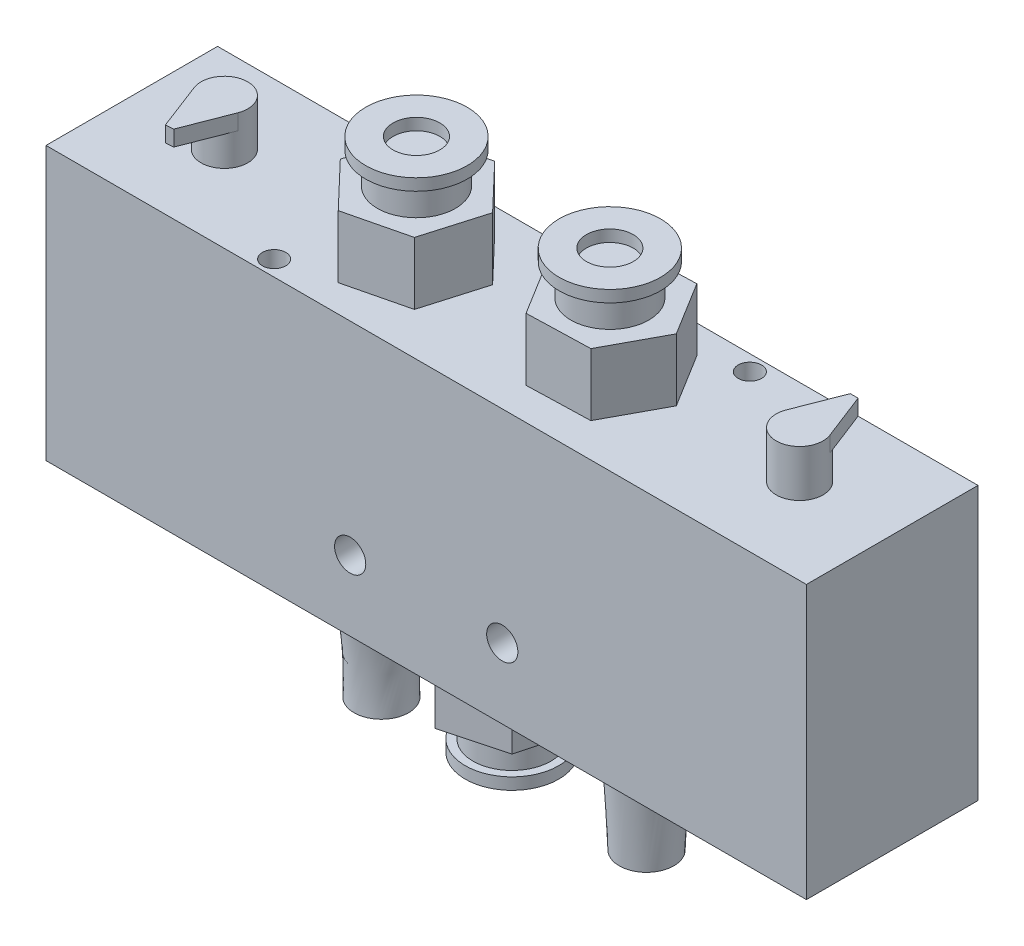
from build123d import *

# Parameters (mm, degrees)
SKETCH1_W            = 97.5
SKETCH1_H            = 35
BOSS_EXTRUDE1_DEPTH  = 22
SKETCH2_R            = 3
BOSS_EXTRUDE2_DEPTH  = 4
BOSS_EXTRUDE3_DEPTH  = 2
BOSS_EXTRUDE4_DEPTH  = 8
SKETCH6_R            = 5
BOSS_EXTRUDE5_DEPTH  = 4
SKETCH7_R            = 6.5
SKETCH7_R_2          = 3
BOSS_EXTRUDE6_DEPTH  = 1.5
BOSS_EXTRUDE8_DEPTH  = 8
BOSS_EXTRUDE9_DEPTH  = 4
SKETCH14_R           = 4
BOSS_EXTRUDE10_DEPTH = 2
SKETCH20_R           = 5
BOSS_EXTRUDE11_DEPTH = 4
SKETCH21_R           = 6
SKETCH21_R_2         = 3
BOSS_EXTRUDE12_DEPTH = 1.5
SKETCH22_R           = 2
CUT_EXTRUDE1_DEPTH   = 28.5
SKETCH25_R           = 1.5
CUT_EXTRUDE3_DEPTH   = 39


with BuildPart() as part:
    # Sketch1 → Boss-Extrude1 (new body)
    with BuildSketch(Plane.XY):
        Rectangle(SKETCH1_W, SKETCH1_H)
    extrude(amount=BOSS_EXTRUDE1_DEPTH)

    # Sketch2 → Boss-Extrude2 (add)
    with BuildSketch(Plane(origin=(0, 17.5, 0), x_dir=(1, 0, 0), z_dir=(0, 1, 0))):
        with Locations((-36.875, -11)):
            Circle(SKETCH2_R)
        with Locations((36.875, -11)):
            Circle(SKETCH2_R)
    extrude(amount=BOSS_EXTRUDE2_DEPTH)

    # Sketch3 → Boss-Extrude3 (add)
    with BuildSketch(Plane(origin=(0, 21.5, 0), x_dir=(1, 0, 0), z_dir=(0, 1, 0))):
        with BuildLine():
            Line((37.375, -4), (36.375, -4))
            Line((36.375, -4), (34.078450474, -9.914039252))
            ThreePointArc((34.078450474, -9.914039252), (36.875, -14), (39.671549526, -9.914039252))
            Line((39.671549526, -9.914039252), (37.375, -4))
        make_face()
        with BuildLine():
            Line((-37.364008965, -18.083081838), (-36.368911019, -17.984187559))
            Line((-36.368911019, -17.984187559), (-34.072361493, -12.070148307))
            ThreePointArc((-34.072361493, -12.070148307), (-36.928299188, -8.000473505), (-39.637849875, -12.169042586))
            Line((-39.637849875, -12.169042586), (-37.364008965, -18.083081838))
        make_face()
    extrude(amount=BOSS_EXTRUDE3_DEPTH)

    # Sketch4 → Boss-Extrude4 (add)
    with BuildSketch(Plane(origin=(0, 17.5, 0), x_dir=(1, 0, 0), z_dir=(0, 1, 0))):
        Polygon((-18.080730298, -4.902882533), (-20.354117415, -12.659495476), (-14.773387117, -18.506612943), (-6.919269702, -16.597117467), (-4.645882585, -8.840504524), (-10.226612883, -2.993387057), align=None)
        Polygon((8.255747213, -3.871071914), (4.420547133, -10.98616669), (8.66479992, -17.865094776), (16.744252787, -17.628928086), (20.579452867, -10.51383331), (16.33520008, -3.634905224), align=None)
    extrude(amount=BOSS_EXTRUDE4_DEPTH)

    # Sketch6 → Boss-Extrude5 (add)
    with BuildSketch(Plane(origin=(0, 25.5, 0), x_dir=(1, 0, 0), z_dir=(0, 1, 0))):
        with Locations(Location((-12.5, -10.75, 0), (0, 0, 180))):
            Circle(SKETCH6_R)
        with Locations(Location((12.295473647, -10.75, 0), (0, 0, 180))):
            Circle(SKETCH6_R)
    extrude(amount=BOSS_EXTRUDE5_DEPTH)

    # Sketch7 → Boss-Extrude6 (add)
    # profile 1 of 2: a face of its own
    with BuildSketch(Plane(origin=(0, 29.5, 0), x_dir=(1, 0, 0), z_dir=(0, 1, 0))):
        with Locations(Location((-12.5, -10.75, 0), (0, 0, 180))):
            Circle(SKETCH7_R)
        with Locations(Location((-12.5, -10.75, 0), (0, 0, 180))):
            Circle(SKETCH7_R_2, mode=Mode.SUBTRACT)
    # profile 2 of 2: a face of its own
    with BuildSketch(Plane(origin=(0, 29.5, 0), x_dir=(1, 0, 0), z_dir=(0, 1, 0))):
        with Locations(Location((12.295473647, -10.75, 0), (0, 0, 180))):
            Circle(SKETCH7_R)
        with Locations(Location((12.295473647, -10.75, 0), (0, 0, 180))):
            Circle(SKETCH7_R_2, mode=Mode.SUBTRACT)
    extrude(amount=BOSS_EXTRUDE6_DEPTH)

    # Sketch9 → Boss-Extrude8 (add)
    with BuildSketch(Plane.XZ.offset(17.5)):
        Polygon((-7.809183897, 13.085660615), (-5.710827024, 5.27987867), (2.098356873, 3.194218055), (7.809183897, 8.914339385), (5.710827024, 16.72012133), (-2.098356873, 18.805781945), align=None)
    extrude(amount=BOSS_EXTRUDE8_DEPTH)

    # Sketch13 → Boss-Extrude9 (add)
    with BuildSketch(Plane.XZ.offset(17.5)):
        Polygon((-22.734354602, 6.861918558), (-16.5, 3.839862519), (-10.765645398, 7.727943962), (-11.265645398, 14.638081442), (-17.5, 17.660137481), (-23.234354602, 13.772056038), align=None)
        Polygon((17.5, 17.660137481), (11.265645398, 14.638081442), (10.765645398, 7.727943962), (16.5, 3.839862519), (22.734354602, 6.861918558), (23.234354602, 13.772056038), align=None)
    extrude(amount=BOSS_EXTRUDE9_DEPTH)

    # Sketch14 → Boss-Extrude10 (add)
    with BuildSketch(Plane.XZ.offset(21.5)):
        with Locations((-17, 10.75)):
            Circle(SKETCH14_R)
        with Locations(Location((17, 10.75, 0), (0, 0, 180))):
            Circle(SKETCH14_R)
    extrude(amount=BOSS_EXTRUDE10_DEPTH)

    # Loft1: read off the stored shape, not the designer's step
    # Loft1: loft between two sections, ruled curve by curve
    loft1_from = [
        Edge.make_bspline([(-20.460745722, -23.5, 8.744198652), (-16.449143026, -23.5, 1.822707208), (-9.527651582, -23.5, 5.834309904), (-13.539254278, -23.5, 12.755801348), (-17.550856974, -23.5, 19.677292792), (-24.472348418, -23.5, 15.665690096), (-20.460745722, -23.5, 8.744198652)], [0, 0, 0, 0, 0.5, 0.5, 0.5, 1, 1, 1, 1], 3, [1, 0.333333333, 0.333333333, 1, 0.333333333, 0.333333333, 1]),
    ]
    loft1_to = [
        Edge.make_bspline([(-18.191787926, -33.5, 7.459157928), (-11.610103782, -33.5, 5.075582077), (-9.226527931, -33.5, 11.65726622), (-15.808212074, -33.5, 14.040842072), (-22.389896218, -33.5, 16.424417923), (-24.773472069, -33.5, 9.84273378), (-18.191787926, -33.5, 7.459157928)], [0, 0, 0, 0, 0.5, 0.5, 0.5, 1, 1, 1, 1], 3, [1, 0.333333333, 0.333333333, 1, 0.333333333, 0.333333333, 1]),
    ]
    loft1 = Solid(Shell([*[Face.make_surface_from_curves(loft1_from[k], loft1_to[k]) for k in range(1)], Face(Wire(loft1_from)), Face(Wire(loft1_to))]))
    add(loft1)

    # Loft4: read off the stored shape, not the designer's step
    # Loft4: loft between two sections, ruled curve by curve
    loft4_from = [
        Edge.make_bspline([(16.912042496, -23.5, 6.750967182), (24.910108131, -23.5, 6.575052174), (25.08602314, -23.5, 14.573117809), (17.087957504, -23.5, 14.749032818), (9.089891869, -23.5, 14.924947826), (8.91397686, -23.5, 6.926882191), (16.912042496, -23.5, 6.750967182)], [0, 0, 0, 0, 0.5, 0.5, 0.5, 1, 1, 1, 1], 3, [1, 0.333333333, 0.333333333, 1, 0.333333333, 0.333333333, 1]),
    ]
    loft4_to = [
        Edge.make_bspline([(17.849097308, -33.5, 7.354556912), (24.639983483, -33.5, 9.052751528), (22.941788868, -33.5, 15.843637703), (16.150902692, -33.5, 14.145443088), (9.360016517, -33.5, 12.447248472), (11.058211132, -33.5, 5.656362297), (17.849097308, -33.5, 7.354556912)], [0, 0, 0, 0, 0.5, 0.5, 0.5, 1, 1, 1, 1], 3, [1, 0.333333333, 0.333333333, 1, 0.333333333, 0.333333333, 1]),
    ]
    loft4 = Solid(Shell([*[Face.make_surface_from_curves(loft4_from[k], loft4_to[k]) for k in range(1)], Face(Wire(loft4_from)), Face(Wire(loft4_to))]))
    add(loft4)

    # Sketch20 → Boss-Extrude11 (add)
    with BuildSketch(Plane.XZ.offset(25.5)):
        with Locations((0, 11)):
            Circle(SKETCH20_R)
    extrude(amount=BOSS_EXTRUDE11_DEPTH)

    # Sketch21 → Boss-Extrude12 (add)
    with BuildSketch(Plane(origin=(0, -29.5, 0), x_dir=(-1, 0, 0), z_dir=(0, -1, 0))):
        with Locations(Location((0, -11, 0), (0, 0, 180))):
            Circle(SKETCH21_R)
        with Locations(Location((0, -11, 0), (0, 0, 180))):
            Circle(SKETCH21_R_2, mode=Mode.SUBTRACT)
    extrude(amount=BOSS_EXTRUDE12_DEPTH)

    # Sketch22 → Cut-Extrude1 (cut)
    with BuildSketch(Plane.XY.offset(22)):
        with Locations((-9.75, -8.5)):
            Circle(SKETCH22_R)
        with Locations((9.75, -8.5)):
            Circle(SKETCH22_R)
    extrude(amount=-CUT_EXTRUDE1_DEPTH, mode=Mode.SUBTRACT)

    # Sketch25 → Cut-Extrude3 (cut)
    with BuildSketch(Plane(origin=(0, 17.5, 0), x_dir=(1, 0, 0), z_dir=(0, 1, 0))):
        with Locations(Location((-21.5, -20, 0), (0, 0, 180))):
            Circle(SKETCH25_R)
        with Locations(Location((21.5, -2, 0), (0, 0, 180))):
            Circle(SKETCH25_R)
    extrude(amount=-CUT_EXTRUDE3_DEPTH, mode=Mode.SUBTRACT)


solid = part.part
